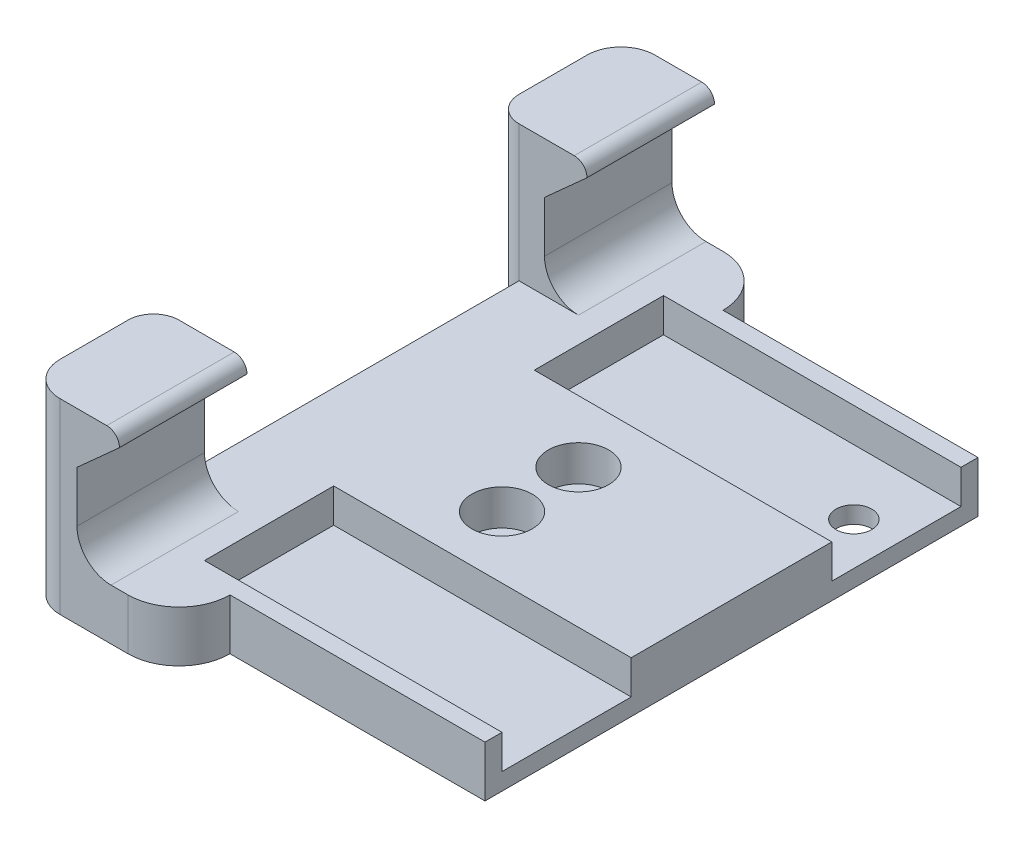
from build123d import *

# Parameters (mm, degrees)
BOSS_EXTRU_1_DEPTH      = 70
ESQUISSE3_W             = 40
ESQUISSE3_H             = 16
ENL_V_MAT_EXTRU_1_DEPTH = 15
CONG_2_R                = 6
ESQUISSE4_W             = 58
ESQUISSE4_H             = 6
BOSS_EXTRU_2_DEPTH      = 30
ENL_V_MAT_EXTRU_2_REACH = 80.655
ESQUISSE5_R             = 2.1
ESQUISSE6_R             = 3.55
ENL_V_MAT_EXTRU_3_DEPTH = 4.2
ESQUISSE8_W             = 15.2
ESQUISSE8_H             = 4
ENL_V_MAT_EXTRU_5_DEPTH = 35
ENL_V_MAT_EXTRU_6_REACH = 80.119
ESQUISSE9_R             = 2.1
ESQUISSE10_W            = 3
ESQUISSE10_H            = 15
BOSS_EXTRU_3_DEPTH      = 22
CONG_3_R                = 3
CONG_4_R                = 4


with BuildPart() as part:
    # Esquisse1 → Boss.-Extru.1 (new body)
    with BuildSketch(Plane.XY):
        with BuildLine():
            Line((-16.668973791, 33.181519274), (-16.668973791, 15.181519274))
            Line((-16.668973791, 15.181519274), (-1.668973791, 15.181519274))
            Line((-1.668973791, 15.181519274), (-1.668973791, 21.181519274))
            Line((-1.668973791, 21.181519274), (-9.668973791, 21.181519274))
            ThreePointArc((-9.668973791, 21.181519274), (-12.497400916, 22.35309215), (-13.668973791, 25.181519274))
            Line((-13.668973791, 25.181519274), (-13.668973791, 31.181519274))
            Line((-13.668973791, 31.181519274), (-8.668973791, 35.681519274))
            ThreePointArc((-8.668973791, 35.681519274), (-9.108313619, 36.742179446), (-10.168973791, 37.181519274))
            Line((-10.168973791, 37.181519274), (-13.668973791, 37.181519274))
            Line((-13.668973791, 37.181519274), (-14.668973791, 37.181519274))
            Line((-14.668973791, 37.181519274), (-16.668973791, 37.181519274))
            Line((-16.668973791, 37.181519274), (-16.668973791, 34.181519274))
            Line((-16.668973791, 34.181519274), (-16.668973791, 33.181519274))
        make_face()
    extrude(amount=BOSS_EXTRU_1_DEPTH)

    # Esquisse3 → Enlèv. mat.-Extru.1 (cut)
    with BuildSketch(Plane.ZY.offset(16.668973791)):
        with Locations((35, 29.181519274)):
            Rectangle(ESQUISSE3_W, ESQUISSE3_H)
    extrude(amount=-ENL_V_MAT_EXTRU_1_DEPTH, mode=Mode.SUBTRACT)

    # Congé2
    cong_2_edges = [part.edges().sort_by_distance(p)[0] for p in [
        (-1.668973791, 18.181519274, 0),
        (-1.668973791, 18.181519274, 70),
    ]]
    fillet(cong_2_edges, radius=CONG_2_R)

    # Esquisse4 → Boss.-Extru.2 (add)
    with BuildSketch(Plane(origin=(-1.668973791, 0, 0), x_dir=(0, 0, -1), z_dir=(1, 0, 0))):
        with Locations((-35, 18.181519274)):
            Rectangle(ESQUISSE4_W, ESQUISSE4_H)
    extrude(amount=BOSS_EXTRU_2_DEPTH)

    # Esquisse5 → Enlèv. mat.-Extru.2 (cut, up to next)
    with BuildSketch(Plane.XZ.offset(-15.181519274), mode=Mode.PRIVATE) as enl_v_mat_extru_2_sk1:
        with Locations(Location((5.831026209, 39.5, 0), (0, 0, 270))):
            Circle(ESQUISSE5_R)
    enl_v_mat_extru_2_tool1 = extrude(enl_v_mat_extru_2_sk1.sketch, amount=-ENL_V_MAT_EXTRU_2_REACH, mode=Mode.PRIVATE) & part.part
    # Esquisse5 → Enlèv. mat.-Extru.2 (cut, up to next)
    with BuildSketch(Plane.XZ.offset(-15.181519274), mode=Mode.PRIVATE) as enl_v_mat_extru_2_sk2:
        with Locations(Location((5.831026209, 30.5, 0), (0, 0, 270))):
            Circle(ESQUISSE5_R)
    enl_v_mat_extru_2_tool2 = extrude(enl_v_mat_extru_2_sk2.sketch, amount=-ENL_V_MAT_EXTRU_2_REACH, mode=Mode.PRIVATE) & part.part
    add(enl_v_mat_extru_2_tool1.solids().sort_by_distance((5.831026, 15.181519, 39.5))[0], mode=Mode.SUBTRACT)
    add(enl_v_mat_extru_2_tool2.solids().sort_by_distance((5.831026, 15.181519, 30.5))[0], mode=Mode.SUBTRACT)

    # Esquisse6 → Enlèv. mat.-Extru.3 (cut)
    with BuildSketch(Plane(origin=(0, 21.181519274, 0), x_dir=(1, 0, 0), z_dir=(0, 1, 0))):
        with Locations(Location((5.831026209, -30.5, 0), (0, 0, 270))):
            Circle(ESQUISSE6_R)
        with Locations(Location((5.831026209, -39.5, 0), (0, 0, 270))):
            Circle(ESQUISSE6_R)
    extrude(amount=-ENL_V_MAT_EXTRU_3_DEPTH, mode=Mode.SUBTRACT)

    # Esquisse8 → Enlèv. mat.-Extru.5 (cut)
    with BuildSketch(Plane(origin=(28.331026209, 0, 0), x_dir=(0, 0, -1), z_dir=(1, 0, 0))):
        with Locations((-54.4, 19.181519274)):
            Rectangle(ESQUISSE8_W, ESQUISSE8_H)
        with Locations((-15.6, 19.181519274)):
            Rectangle(ESQUISSE8_W, ESQUISSE8_H)
    extrude(amount=-ENL_V_MAT_EXTRU_5_DEPTH, mode=Mode.SUBTRACT)

    # Esquisse9 → Enlèv. mat.-Extru.6 (cut, up to next)
    with BuildSketch(Plane(origin=(0, 17.181519274, 0), x_dir=(1, 0, 0), z_dir=(0, 1, 0)), mode=Mode.PRIVATE) as enl_v_mat_extru_6_sk1:
        with Locations(Location((23.331026209, -15.604527367, 0), (0, 0, 180))):
            Circle(ESQUISSE9_R)
    enl_v_mat_extru_6_tool1 = extrude(enl_v_mat_extru_6_sk1.sketch, amount=-ENL_V_MAT_EXTRU_6_REACH, mode=Mode.PRIVATE) & part.part
    add(enl_v_mat_extru_6_tool1.solids().sort_by_distance((23.331026, 17.181519, 15.604527))[0], mode=Mode.SUBTRACT)

    # Esquisse10 → Boss.-Extru.3 (add)
    with BuildSketch(Plane.XZ.offset(-15.181519274)):
        with Locations((-18.168973791, 62.5)):
            Rectangle(ESQUISSE10_W, ESQUISSE10_H)
        with Locations((-18.168973791, 7.5)):
            Rectangle(ESQUISSE10_W, ESQUISSE10_H)
    extrude(amount=-BOSS_EXTRU_3_DEPTH)

    # Congé3
    cong_3_edges = [part.edges().sort_by_distance(p)[0] for p in [
        (-19.668973791, 26.181519274, 55),
        (-19.668973791, 26.181519274, 15),
    ]]
    fillet(cong_3_edges, radius=CONG_3_R - 0.0001)  # a hair under: the kernel refuses the full size

    # Congé4
    cong_4_edges = [part.edges().sort_by_distance(p)[0] for p in [
        (-19.668973791, 26.181519274, 70),
        (-19.668973791, 26.181519274, 0),
    ]]
    fillet(cong_4_edges, radius=CONG_4_R)


solid = part.part
